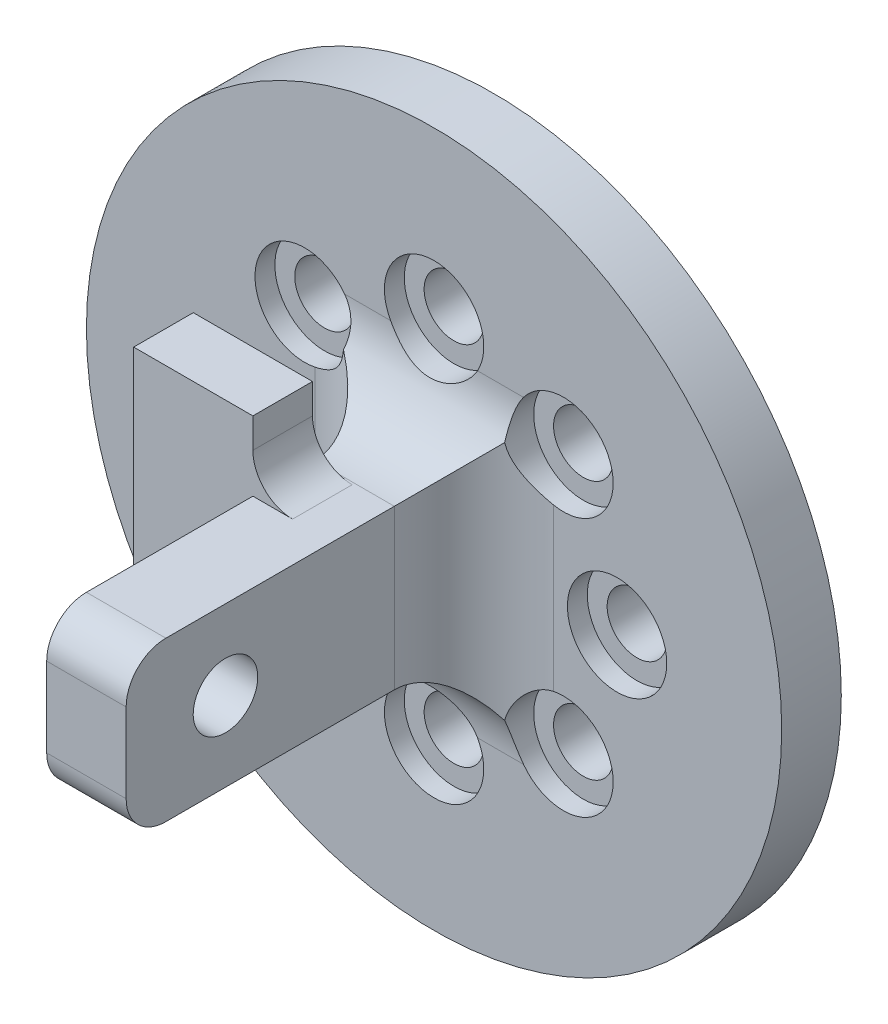
from build123d import *

# Parameters (mm, degrees)
SKETCH1_R           = 35
SKETCH1_R_2         = 3
BOSS_EXTRUDE1_DEPTH = 6
SKETCH4_R           = 5
CUT_EXTRUDE1_DEPTH  = 2
SKETCH5_W           = 8
SKETCH5_H           = 16
BOSS_EXTRUDE2_DEPTH = 35
SKETCH6_R           = 3.25
CUT_EXTRUDE2_DEPTH  = 67.535704701
FILLET1_R           = 8
FILLET2_R           = 4
SKETCH7_W           = 6
SKETCH7_H           = 30
BOSS_EXTRUDE3_DEPTH = 12
FILLET3_R           = 4


with BuildPart() as part:
    # Sketch1 → Boss-Extrude1 (new body)
    with BuildSketch(Plane.XY):
        Circle(SKETCH1_R)
        with Locations((0, 18.425417274)):
            Circle(SKETCH1_R_2, mode=Mode.SUBTRACT)
        with Locations((13.028737501, 13.028737501)):
            Circle(SKETCH1_R_2, mode=Mode.SUBTRACT)
        with Locations((18.425417274, 0)):
            Circle(SKETCH1_R_2, mode=Mode.SUBTRACT)
        with Locations((13.028737501, -13.028737501)):
            Circle(SKETCH1_R_2, mode=Mode.SUBTRACT)
        with Locations((0, -18.425417274)):
            Circle(SKETCH1_R_2, mode=Mode.SUBTRACT)
        with Locations((-13.028737501, -13.028737501)):
            Circle(SKETCH1_R_2, mode=Mode.SUBTRACT)
        with Locations((-18.425417274, 0)):
            Circle(SKETCH1_R_2, mode=Mode.SUBTRACT)
        with Locations((-13.028737501, 13.028737501)):
            Circle(SKETCH1_R_2, mode=Mode.SUBTRACT)
    extrude(amount=BOSS_EXTRUDE1_DEPTH)

    # Sketch4 → Cut-Extrude1 (cut)
    with BuildSketch(Plane.XY.offset(6)):
        with Locations((0, 18.425417274)):
            Circle(SKETCH4_R)
        with Locations((13.028737501, 13.028737501)):
            Circle(SKETCH4_R)
        with Locations((18.425417274, 0)):
            Circle(SKETCH4_R)
        with Locations((13.028737501, -13.028737501)):
            Circle(SKETCH4_R)
        with Locations((0, -18.425417274)):
            Circle(SKETCH4_R)
        with Locations((-13.028737501, -13.028737501)):
            Circle(SKETCH4_R)
        with Locations((-18.425417274, 0)):
            Circle(SKETCH4_R)
        with Locations((-13.028737501, 13.028737501)):
            Circle(SKETCH4_R)
    extrude(amount=-CUT_EXTRUDE1_DEPTH, mode=Mode.SUBTRACT)

    # Sketch5 → Boss-Extrude2 (add)
    with BuildSketch(Plane.XY.offset(6)):
        Rectangle(SKETCH5_W, SKETCH5_H)
    extrude(amount=BOSS_EXTRUDE2_DEPTH)

    # Sketch6 → Cut-Extrude2 (cut, through all)
    with BuildSketch(Plane(origin=(4, 0, 0), x_dir=(0, 0, -1), z_dir=(1, 0, 0))):
        with Locations(Location((-31, 0, 0), (0, 0, 90))):
            Circle(SKETCH6_R)
    extrude(amount=-CUT_EXTRUDE2_DEPTH, mode=Mode.SUBTRACT)

    # Fillet1
    # the kernel refuses this fillet: 8 mm, written as the material it adds along each edge
    with BuildSketch(Plane(origin=(4, 8, 6), x_dir=(1, 0, 0), z_dir=(0, -1, 0)), Plane(origin=(-4, -8, 6), x_dir=(-1, 0, 0), z_dir=(0, 1, 0))) as fillet1_piece_1:
        with BuildLine():
            CenterArc((FILLET1_R, FILLET1_R), FILLET1_R, 180, 90)
            Line((0, FILLET1_R), (0, 0))
            Line((0, 0), (FILLET1_R, 0))
        make_face()
    extrude(amount=16)
    with BuildSketch(Plane(origin=(-4, 8, 6), x_dir=(0, 1, 0), z_dir=(1, 0, 0))) as fillet1_piece_2_section:
        with BuildLine():
            CenterArc((FILLET1_R, FILLET1_R), FILLET1_R, 180, 90)
            Line((0, FILLET1_R), (0, 0))
            Line((0, 0), (FILLET1_R, 0))
        make_face()
    fillet1_piece_2 = extrude(amount=8, mode=Mode.PRIVATE)
    fillet1_piece_2 = fillet1_piece_2 - Plane(origin=(0, 18.425417274, 7.870474633), x_dir=(1, 0, 0), z_dir=(0, 0, 1)) * Cylinder(5, 48, mode=Mode.PRIVATE)
    add(fillet1_piece_2)
    with BuildSketch(Plane(origin=(4, -8, 6), x_dir=(0, -1, 0), z_dir=(-1, 0, 0))) as fillet1_piece_3_section:
        with BuildLine():
            CenterArc((FILLET1_R, FILLET1_R), FILLET1_R, 180, 90)
            Line((0, FILLET1_R), (0, 0))
            Line((0, 0), (FILLET1_R, 0))
        make_face()
    fillet1_piece_3 = extrude(amount=8, mode=Mode.PRIVATE)
    fillet1_piece_3 = fillet1_piece_3 - Plane(origin=(0, -18.425417274, 7.870474633), x_dir=(1, 0, 0), z_dir=(0, 0, 1)) * Cylinder(5, 48, mode=Mode.PRIVATE)
    add(fillet1_piece_3)
    with BuildSketch(Plane(origin=(4, 28, 6), x_dir=(1, 0, 0), z_dir=(0, -1, 0))) as fillet1_piece_4a_section:
        with BuildLine():
            CenterArc((FILLET1_R, FILLET1_R), FILLET1_R, 180, 90)
            Line((0, FILLET1_R), (0, 0))
            Line((0, 0), (FILLET1_R, 0))
        make_face()
    fillet1_piece_4a = extrude(amount=36, mode=Mode.PRIVATE)
    fillet1_piece_4a = fillet1_piece_4a - Plane(origin=(0, 18.425417274, 7.7362908), x_dir=(1, 0, 0), z_dir=(0, 0, 1)) * Cylinder(5, 104, mode=Mode.PRIVATE)
    fillet1_piece_4a = fillet1_piece_4a - Plane(origin=(13.028737501, 13.028737501, 7.7362908), x_dir=(1, 0, 0), z_dir=(0, 0, 1)) * Cylinder(5, 104, mode=Mode.PRIVATE)
    fillet1_piece_4a = split(fillet1_piece_4a, bisect_by=Plane(origin=(5.823576256, 8, 7.7362908), z_dir=(0, 1, 0)), keep=Keep.TOP, mode=Mode.PRIVATE)
    with BuildSketch(Plane(origin=(-4, 8, 6), x_dir=(0, 1, 0), z_dir=(1, 0, 0))) as fillet1_piece_4b_section:
        with BuildLine():
            CenterArc((FILLET1_R, FILLET1_R), FILLET1_R, 180, 90)
            Line((0, FILLET1_R), (0, 0))
            Line((0, 0), (FILLET1_R, 0))
        make_face()
    fillet1_piece_4b = extrude(amount=28, mode=Mode.PRIVATE)
    fillet1_piece_4b = fillet1_piece_4b - Plane(origin=(0, 18.425417274, 6.213712954), x_dir=(1, 0, 0), z_dir=(0, 0, 1)) * Cylinder(5, 88, mode=Mode.PRIVATE)
    fillet1_piece_4b = fillet1_piece_4b - Plane(origin=(13.028737501, 13.028737501, 6.213712954), x_dir=(1, 0, 0), z_dir=(0, 0, 1)) * Cylinder(5, 88, mode=Mode.PRIVATE)
    fillet1_piece_4b = split(fillet1_piece_4b, bisect_by=Plane(origin=(4, 13.913670674, 6.213712954), z_dir=(1, 0, 0)), keep=Keep.TOP, mode=Mode.PRIVATE)
    fillet1_piece_4 = fillet1_piece_4a & fillet1_piece_4b
    add(fillet1_piece_4)
    with BuildSketch(Plane(origin=(24, -8, 6), x_dir=(0, -1, 0), z_dir=(-1, 0, 0))) as fillet1_piece_5a_section:
        with BuildLine():
            CenterArc((FILLET1_R, FILLET1_R), FILLET1_R, 180, 90)
            Line((0, FILLET1_R), (0, 0))
            Line((0, 0), (FILLET1_R, 0))
        make_face()
    fillet1_piece_5a = extrude(amount=28, mode=Mode.PRIVATE)
    fillet1_piece_5a = fillet1_piece_5a - Plane(origin=(0, -18.425417274, 6.213686684), x_dir=(1, 0, 0), z_dir=(0, 0, 1)) * Cylinder(5, 88, mode=Mode.PRIVATE)
    fillet1_piece_5a = fillet1_piece_5a - Plane(origin=(13.028737501, -13.028737501, 6.213686684), x_dir=(1, 0, 0), z_dir=(0, 0, 1)) * Cylinder(5, 88, mode=Mode.PRIVATE)
    fillet1_piece_5a = split(fillet1_piece_5a, bisect_by=Plane(origin=(4, -13.913663635, 6.213686684), z_dir=(1, 0, 0)), keep=Keep.TOP, mode=Mode.PRIVATE)
    with BuildSketch(Plane(origin=(4, 8, 6), x_dir=(1, 0, 0), z_dir=(0, -1, 0))) as fillet1_piece_5b_section:
        with BuildLine():
            CenterArc((FILLET1_R, FILLET1_R), FILLET1_R, 180, 90)
            Line((0, FILLET1_R), (0, 0))
            Line((0, 0), (FILLET1_R, 0))
        make_face()
    fillet1_piece_5b = extrude(amount=36, mode=Mode.PRIVATE)
    fillet1_piece_5b = fillet1_piece_5b - Plane(origin=(0, -18.425417274, 7.736290735), x_dir=(1, 0, 0), z_dir=(0, 0, 1)) * Cylinder(5, 104, mode=Mode.PRIVATE)
    fillet1_piece_5b = fillet1_piece_5b - Plane(origin=(13.028737501, -13.028737501, 7.736290735), x_dir=(1, 0, 0), z_dir=(0, 0, 1)) * Cylinder(5, 104, mode=Mode.PRIVATE)
    fillet1_piece_5b = split(fillet1_piece_5b, bisect_by=Plane(origin=(5.823577009, -8, 7.736290735), z_dir=(0, -1, 0)), keep=Keep.TOP, mode=Mode.PRIVATE)
    fillet1_piece_5 = fillet1_piece_5a & fillet1_piece_5b
    add(fillet1_piece_5)
    with BuildSketch(Plane(origin=(-4, -8, 6), x_dir=(-1, 0, 0), z_dir=(0, 1, 0))) as fillet1_piece_6a_section:
        with BuildLine():
            CenterArc((FILLET1_R, FILLET1_R), FILLET1_R, 180, 90)
            Line((0, FILLET1_R), (0, 0))
            Line((0, 0), (FILLET1_R, 0))
        make_face()
    fillet1_piece_6a = extrude(amount=36, mode=Mode.PRIVATE)
    fillet1_piece_6a = fillet1_piece_6a - Plane(origin=(-13.028737501, 13.028737501, 7.736291892), x_dir=(1, 0, 0), z_dir=(0, 0, 1)) * Cylinder(5, 104, mode=Mode.PRIVATE)
    fillet1_piece_6a = fillet1_piece_6a - Plane(origin=(0, 18.425417274, 7.736291892), x_dir=(1, 0, 0), z_dir=(0, 0, 1)) * Cylinder(5, 104, mode=Mode.PRIVATE)
    fillet1_piece_6a = split(fillet1_piece_6a, bisect_by=Plane(origin=(-5.823575173, 8, 7.736291892), z_dir=(0, 1, 0)), keep=Keep.TOP, mode=Mode.PRIVATE)
    with BuildSketch(Plane(origin=(-24, 8, 6), x_dir=(0, 1, 0), z_dir=(1, 0, 0))) as fillet1_piece_6b_section:
        with BuildLine():
            CenterArc((FILLET1_R, FILLET1_R), FILLET1_R, 180, 90)
            Line((0, FILLET1_R), (0, 0))
            Line((0, 0), (FILLET1_R, 0))
        make_face()
    fillet1_piece_6b = extrude(amount=28, mode=Mode.PRIVATE)
    fillet1_piece_6b = fillet1_piece_6b - Plane(origin=(-13.028737501, 13.028737501, 6.213714747), x_dir=(1, 0, 0), z_dir=(0, 0, 1)) * Cylinder(5, 88, mode=Mode.PRIVATE)
    fillet1_piece_6b = fillet1_piece_6b - Plane(origin=(0, 18.425417274, 6.213714747), x_dir=(1, 0, 0), z_dir=(0, 0, 1)) * Cylinder(5, 88, mode=Mode.PRIVATE)
    fillet1_piece_6b = split(fillet1_piece_6b, bisect_by=Plane(origin=(-4, 13.913671155, 6.213714747), z_dir=(-1, 0, 0)), keep=Keep.TOP, mode=Mode.PRIVATE)
    fillet1_piece_6 = fillet1_piece_6a & fillet1_piece_6b
    add(fillet1_piece_6)
    with BuildSketch(Plane(origin=(-4, -28, 6), x_dir=(-1, 0, 0), z_dir=(0, 1, 0))) as fillet1_piece_7a_section:
        with BuildLine():
            CenterArc((FILLET1_R, FILLET1_R), FILLET1_R, 180, 90)
            Line((0, FILLET1_R), (0, 0))
            Line((0, 0), (FILLET1_R, 0))
        make_face()
    fillet1_piece_7a = extrude(amount=36, mode=Mode.PRIVATE)
    fillet1_piece_7a = fillet1_piece_7a - Plane(origin=(-13.028737501, -13.028737501, 7.736291939), x_dir=(1, 0, 0), z_dir=(0, 0, 1)) * Cylinder(5, 104, mode=Mode.PRIVATE)
    fillet1_piece_7a = fillet1_piece_7a - Plane(origin=(0, -18.425417274, 7.736291939), x_dir=(1, 0, 0), z_dir=(0, 0, 1)) * Cylinder(5, 104, mode=Mode.PRIVATE)
    fillet1_piece_7a = split(fillet1_piece_7a, bisect_by=Plane(origin=(-5.823575033, -8, 7.736291939), z_dir=(0, -1, 0)), keep=Keep.TOP, mode=Mode.PRIVATE)
    with BuildSketch(Plane(origin=(4, -8, 6), x_dir=(0, -1, 0), z_dir=(-1, 0, 0))) as fillet1_piece_7b_section:
        with BuildLine():
            CenterArc((FILLET1_R, FILLET1_R), FILLET1_R, 180, 90)
            Line((0, FILLET1_R), (0, 0))
            Line((0, 0), (FILLET1_R, 0))
        make_face()
    fillet1_piece_7b = extrude(amount=28, mode=Mode.PRIVATE)
    fillet1_piece_7b = fillet1_piece_7b - Plane(origin=(-13.028737501, -13.028737501, 6.213687212), x_dir=(1, 0, 0), z_dir=(0, 0, 1)) * Cylinder(5, 88, mode=Mode.PRIVATE)
    fillet1_piece_7b = fillet1_piece_7b - Plane(origin=(0, -18.425417274, 6.213687212), x_dir=(1, 0, 0), z_dir=(0, 0, 1)) * Cylinder(5, 88, mode=Mode.PRIVATE)
    fillet1_piece_7b = split(fillet1_piece_7b, bisect_by=Plane(origin=(-4, -13.913663776, 6.213687212), z_dir=(-1, 0, 0)), keep=Keep.TOP, mode=Mode.PRIVATE)
    fillet1_piece_7 = fillet1_piece_7a & fillet1_piece_7b
    add(fillet1_piece_7)

    # Fillet2
    fillet2_edges = [part.edges().sort_by_distance(p)[0] for p in [
        (0, 8, 41),
        (0, -8, 41),
    ]]
    fillet(fillet2_edges, radius=FILLET2_R)

    # Sketch7 → Boss-Extrude3 (add)
    with BuildSketch(Plane.ZY.offset(4)):
        with Locations((17.24, 0)):
            Rectangle(SKETCH7_W, SKETCH7_H)
    extrude(amount=BOSS_EXTRUDE3_DEPTH)

    # Fillet3
    # the kernel refuses this fillet: 4 mm, written as the material it adds along each edge
    with BuildSketch(Plane(origin=(-4, -8, 14.24), x_dir=(1, 0, 0), z_dir=(0, 0, 1))) as fillet3_piece_1:
        with BuildLine():
            CenterArc((FILLET3_R, -FILLET3_R), FILLET3_R, 90, 90)
            Line((0, -FILLET3_R), (0, 0))
            Line((0, 0), (FILLET3_R, 0))
        make_face()
    extrude(amount=6)
    with BuildSketch(Plane(origin=(-4, 8, 14.24), x_dir=(1, 0, 0), z_dir=(0, 0, 1))) as fillet3_piece_2:
        with BuildLine():
            CenterArc((FILLET3_R, FILLET3_R), FILLET3_R, 180, 90)
            Line((0, FILLET3_R), (0, 0))
            Line((0, 0), (FILLET3_R, 0))
        make_face()
    extrude(amount=6)


solid = part.part
